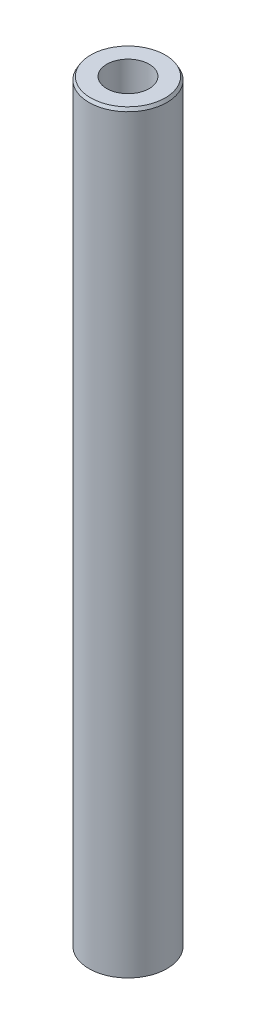
from build123d import *
from OCP.BRepFilletAPI import BRepFilletAPI_MakeChamfer

# Parameters (mm, degrees)
SKETCH1_R           = 12.5
BOSS_EXTRUDE1_DEPTH = 241.917062889
SKETCH2_R           = 6.790410141
CUT_EXTRUDE1_DEPTH  = 243.562085489
CHAMFER1_SIZE       = 0.979733199
CHAMFER1_SIZE2      = 0.565649226


with BuildPart() as part:
    # Sketch1 → Boss-Extrude1 (new body)
    with BuildSketch(Plane(origin=(0, 0, 0), x_dir=(1, 0, 0), z_dir=(0, 1, 0))):
        Circle(SKETCH1_R)
    extrude(amount=BOSS_EXTRUDE1_DEPTH)

    # Sketch2 → Cut-Extrude1 (cut, through all)
    with BuildSketch(Plane(origin=(0, 0, 0), x_dir=(1, 0, 0), z_dir=(0, 1, 0))):
        Circle(SKETCH2_R)
    extrude(amount=CUT_EXTRUDE1_DEPTH, mode=Mode.SUBTRACT)

    # Chamfer1: one chamfer whose edges measure the first distance from different faces: ONE call of the kernel's chamfer builder (chamfer() names one face for all edges)
    chamfer1_edges_1 = [part.edges().sort_by_distance(p)[0] for p in [
        (-12.5, 241.917062889, 0),
    ]]
    chamfer1_side_1 = [part.faces().sort_by_distance(p)[0] for p in [
        (-12.5, 120.958531444, 0),
    ]]
    chamfer1_edges_2 = [part.edges().sort_by_distance(p)[0] for p in [
        (-12.5, 0, 0),
    ]]
    chamfer1_side_2 = [part.faces().sort_by_distance(p)[0] for p in [
        (-12.146446609, 0, 0),
    ]]
    chamfer1 = BRepFilletAPI_MakeChamfer(part.part.solid().wrapped)
    for e in chamfer1_edges_1:
        chamfer1.Add(CHAMFER1_SIZE, CHAMFER1_SIZE2, e.wrapped, chamfer1_side_1[0].wrapped)  # the first distance lies on this face
    for e in chamfer1_edges_2:
        chamfer1.Add(CHAMFER1_SIZE, CHAMFER1_SIZE2, e.wrapped, chamfer1_side_2[0].wrapped)  # the first distance lies on this face
    add(Compound.cast(chamfer1.Shape()), mode=Mode.REPLACE)


solid = part.part
